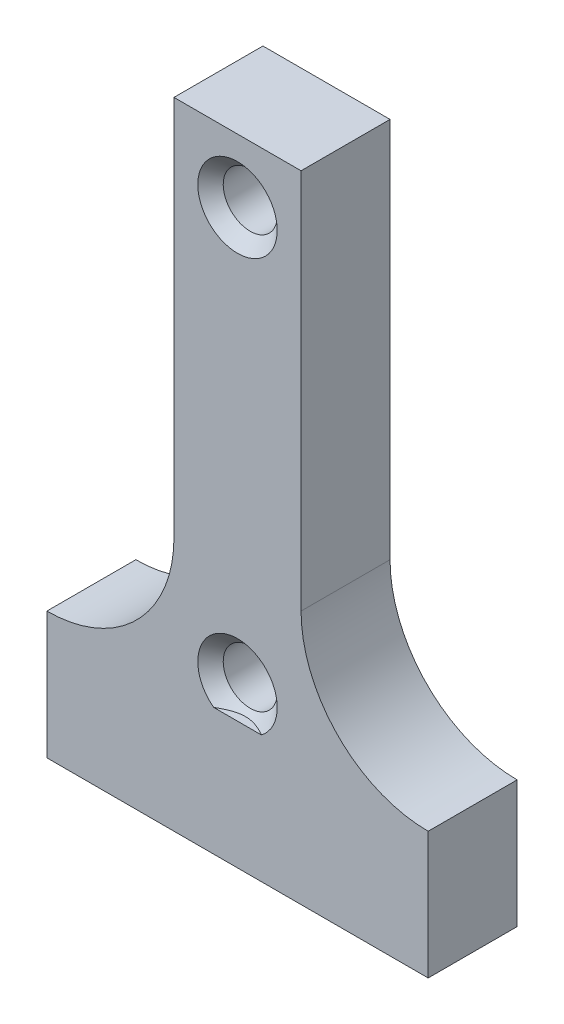
from build123d import *

# Parameters (mm, degrees)
SKETCH1_W           = 10
SKETCH1_H           = 40
BOSS_EXTRUDE1_DEPTH = 7
SKETCH2_R           = 2.125
CUT_EXTRUDE1_DEPTH  = 7
CHAMFER1_SIZE       = 1
SKETCH3_W           = 30
SKETCH3_H           = 7
BOSS_EXTRUDE2_DEPTH = 10
FILLET1_R           = 10


# Some blends are built 0.0001 mm under size
with BuildPart() as part:
    # Sketch1 → Boss-Extrude1 (new body)
    with BuildSketch(Plane.XY):
        with Locations((5, 20)):
            Rectangle(SKETCH1_W, SKETCH1_H)
    extrude(amount=BOSS_EXTRUDE1_DEPTH)

    # Sketch2 → Cut-Extrude1 (cut)
    with BuildSketch(Plane.XY.offset(7)):
        with Locations((5, 35)):
            Circle(SKETCH2_R)
        with Locations((5, 2.5)):
            Circle(SKETCH2_R)
    extrude(amount=-CUT_EXTRUDE1_DEPTH, mode=Mode.SUBTRACT)

    # Chamfer1
    # the kernel refuses this chamfer: 1 mm, written as the material it takes off along each edge
    with BuildSketch(Plane(origin=(5, 35, 7), x_dir=(1, 0, 0), z_dir=(0, -1, 0))) as chamfer1_piece_1:
        Polygon((2.125 + CHAMFER1_SIZE, 0), (2.125, -CHAMFER1_SIZE), (2.125, 0), align=None)
    revolve(axis=Axis((5, 35, 7), (0, 0, 1)), mode=Mode.SUBTRACT)
    with BuildSketch(Plane(origin=(5, 2.5, 7), x_dir=(1, 0, 0), z_dir=(0, -1, 0))) as chamfer1_piece_2:
        Polygon((2.125 + CHAMFER1_SIZE, 0), (2.125, -CHAMFER1_SIZE), (2.125, 0), align=None)
    revolve(axis=Axis((5, 2.5, 7), (0, 0, 1)), mode=Mode.SUBTRACT)

    # Sketch3 → Boss-Extrude2 (add)
    with BuildSketch(Plane.XZ):
        with Locations((5, 3.5)):
            Rectangle(SKETCH3_W, SKETCH3_H)
    extrude(amount=BOSS_EXTRUDE2_DEPTH)

    # Fillet1
    fillet1_edges = [part.edges().sort_by_distance(p)[0] for p in [
        (0, 0, 3.5),
        (10, 0, 3.5),
    ]]
    fillet(fillet1_edges, radius=FILLET1_R - 0.0001)  # a hair under: the kernel refuses the full size


solid = part.part
